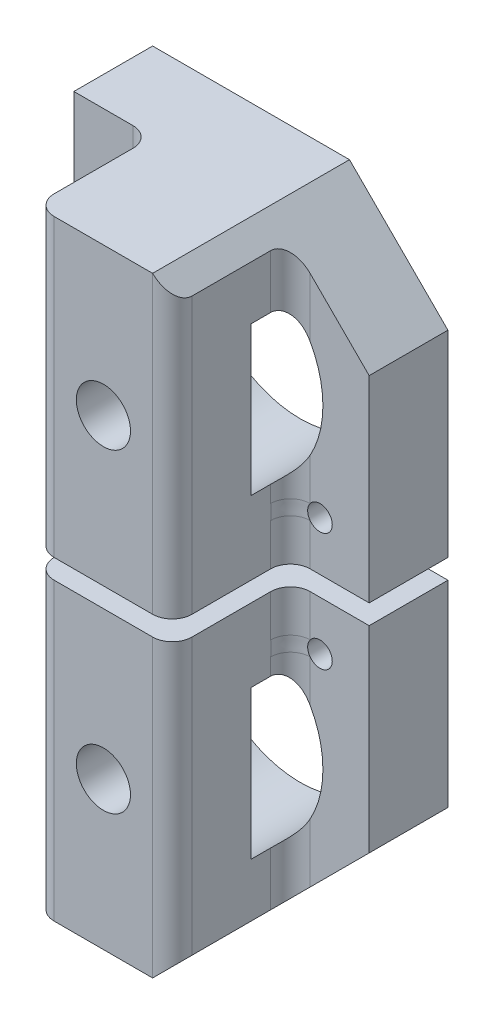
from build123d import *

# Parameters (mm, degrees)
SKETCH1_R          = 1.25
MAIN_DEPTH         = 20
SKETCH2_R          = 10.3
CENTRALHOLE_DEPTH  = 12
SKETCH5_R          = 2.75
SKETCH5_W          = 8
SKETCH5_H          = 30
CUT_EXTRUDE3_DEPTH = 12
FILLET1_R          = 2


with BuildPart() as part:
    # Sketch1 → Main (new body)
    with BuildSketch(Plane.XY):
        Polygon((-15, -15), (5, -15), (15, -5), (15, 15), (-15, 15), align=None)
        with Locations((-10, 10)):
            Circle(SKETCH1_R, mode=Mode.SUBTRACT)
        with Locations((10, 10)):
            Circle(SKETCH1_R, mode=Mode.SUBTRACT)
        with Locations((-10, -10)):
            Circle(SKETCH1_R, mode=Mode.SUBTRACT)
    extrude(amount=MAIN_DEPTH)

    # Sketch2 → CentralHole (cut)
    with BuildSketch(Plane.XY):
        Circle(SKETCH2_R)
    extrude(amount=CENTRALHOLE_DEPTH, mode=Mode.SUBTRACT)

    # Sketch5 → Cut-Extrude3 (cut)
    with BuildSketch(Plane.XY.offset(20)):
        Circle(SKETCH5_R)
        with Locations((11, 0)):
            Rectangle(SKETCH5_W, SKETCH5_H)
        with Locations((-11, 0)):
            Rectangle(SKETCH5_W, SKETCH5_H)
    extrude(amount=-CUT_EXTRUDE3_DEPTH, mode=Mode.SUBTRACT)

    # Fillet1
    fillet1_edges = [part.edges().sort_by_distance(p)[0] for p in [
        (-7, 0, 20),
        (7, 1, 20),
        (-7, -11.27789624, 8),
        (-7, 11.27789624, 8),
        (7, 11.27789624, 8),
        (7, -10.27789624, 8),
    ]]
    fillet(fillet1_edges, radius=FILLET1_R)


with BuildPart() as body_2:
    # Mirror1: mirrored copy
    add(part.part.mirror(Plane.ZX.offset(16)))


solid = Compound([part.part, body_2.part])
